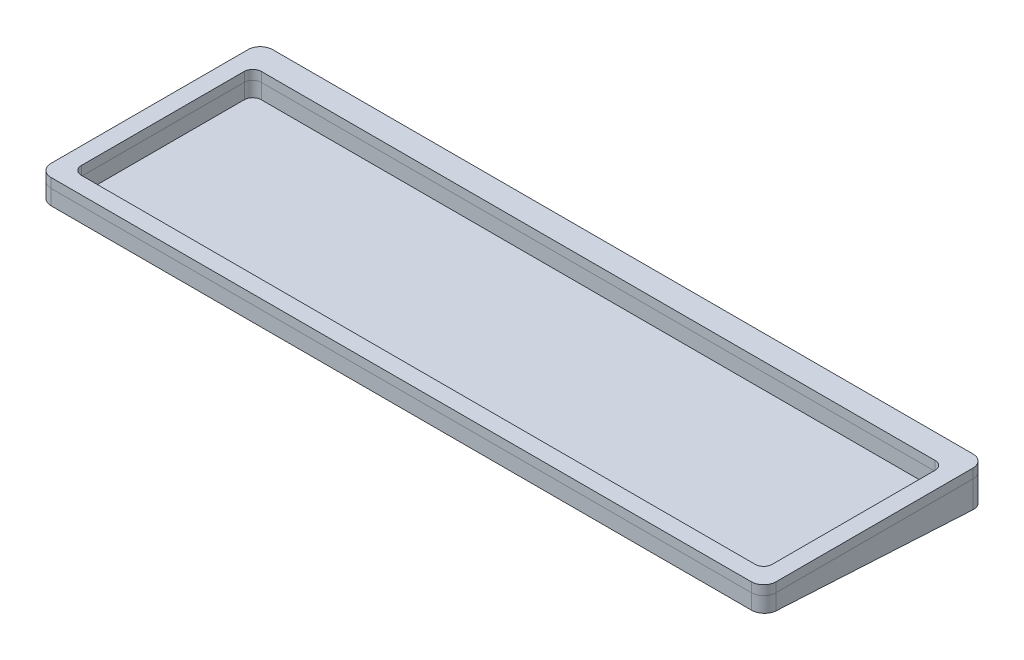
from build123d import *

# Parameters (mm, degrees)
SKETCH2_W           = 383.65
SKETCH2_H           = 117.25
SKETCH2_W_2         = 365.65
SKETCH2_H_2         = 95.25
BOSS_EXTRUDE1_DEPTH = 13
SKETCH4_W           = 383.65
SKETCH4_H           = 117.25
BOSS_EXTRUDE3_DEPTH = 10.5
CUT_EXTRUDE1_DEPTH  = 400
FILLET1_R           = 6.5
FILLET2_R           = 4.5


with BuildPart() as part:
    # Sketch2 → Boss-Extrude1 (new body)
    with BuildSketch(Plane(origin=(0, 0, 0), x_dir=(1, 0, 0), z_dir=(0, 1, 0))):
        with Locations((0, 2)):
            Rectangle(SKETCH2_W, SKETCH2_H)
        Rectangle(SKETCH2_W_2, SKETCH2_H_2, mode=Mode.SUBTRACT)
    extrude(amount=BOSS_EXTRUDE1_DEPTH)

    # Sketch4 → Boss-Extrude3 (add)
    with BuildSketch(Plane.XZ):
        with Locations((0, -2)):
            Rectangle(SKETCH4_W, SKETCH4_H)
    extrude(amount=BOSS_EXTRUDE3_DEPTH)

    # Sketch11 → Cut-Extrude1 (cut)
    with BuildSketch(Plane.ZY.offset(191.825)):
        Polygon((-60.625, -10.5), (-60.625, -6.5), (56.625, 0), (56.625, -10.5), align=None)
    extrude(amount=-CUT_EXTRUDE1_DEPTH, mode=Mode.SUBTRACT)

    # Fillet1
    fillet1_edges = [part.edges().sort_by_distance(p)[0] for p in [
        (191.825, 3.25, -60.625),
        (191.825, 6.5, 56.625),
        (-191.825, 6.5, 56.625),
        (-191.825, 3.25, -60.625),
    ]]
    fillet(fillet1_edges, radius=FILLET1_R)

    # Fillet2
    fillet2_edges = [part.edges().sort_by_distance(p)[0] for p in [
        (182.825, 6.5, 47.625),
        (-182.825, 6.5, 47.625),
        (182.825, 6.5, -47.625),
        (-182.825, 6.5, -47.625),
    ]]
    fillet(fillet2_edges, radius=FILLET2_R)


with BuildPart() as body_2:
    # Split1: the piece on the far side of the plane
    add(part.part)
    split(bisect_by=Plane.ZX.offset(8), keep=Keep.BOTTOM)


with BuildPart() as part_1:
    add(part.part)

    # Split1
    split(bisect_by=Plane.ZX.offset(8), keep=Keep.TOP)


solid = Compound([body_2.part, part_1.part])
